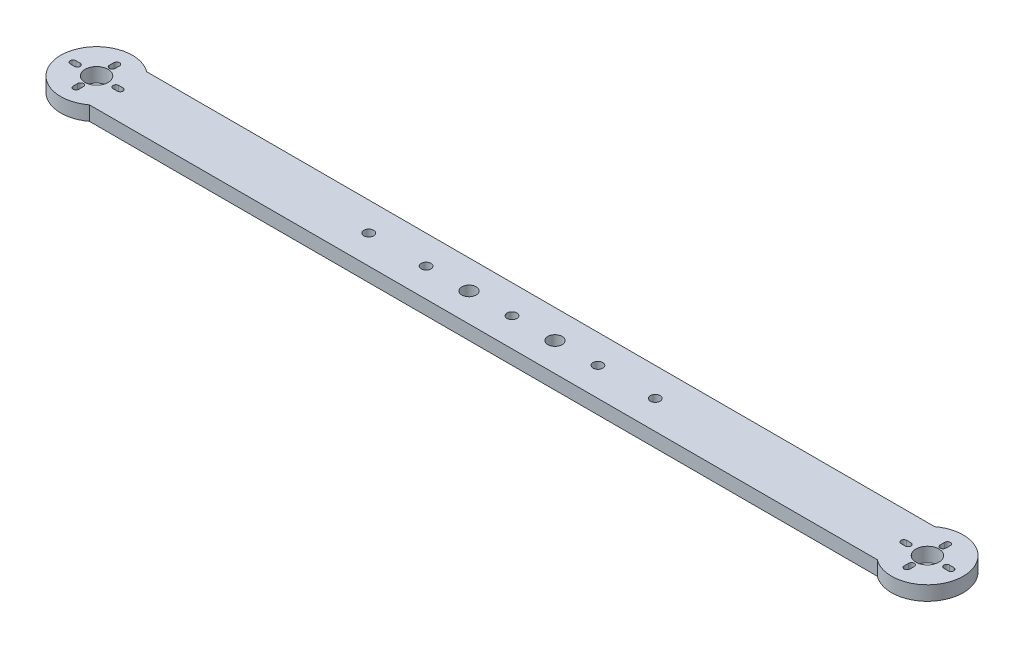
from build123d import *

# Parameters (mm, degrees)
BOSS_EXTRUDE1_DEPTH = 6.35
SKETCH2_R           = 5.08
CUT_EXTRUDE1_DEPTH  = 201.754423986
SKETCH3_R           = 2.159
CUT_EXTRUDE2_DEPTH  = 201.754423986
SKETCH4_R           = 3.175
CUT_EXTRUDE3_DEPTH  = 201.754423986
SKETCH5_R           = 2.159
CUT_EXTRUDE4_DEPTH  = 201.754423986


with BuildPart() as part:
    # Sketch1 → Boss-Extrude1 (new body)
    with BuildSketch(Plane(origin=(0, 0, 0), x_dir=(1, 0, 0), z_dir=(0, 1, 0))):
        with BuildLine():
            Line((-174.625, 12.7), (174.625, 12.7))
            ThreePointArc((174.625, 12.7), (200.025, 0), (174.625, -12.7))
            Line((174.625, -12.7), (-174.625, -12.7))
            ThreePointArc((-174.625, -12.7), (-200.025, 0), (-174.625, 12.7))
        make_face()
    extrude(amount=BOSS_EXTRUDE1_DEPTH)

    # Sketch2 → Cut-Extrude1 (cut, through all)
    with BuildSketch(Plane(origin=(0, 6.35, 0), x_dir=(1, 0, 0), z_dir=(0, 1, 0))):
        with Locations((184.15, 0)):
            Circle(SKETCH2_R)
        with Locations((-184.15, 0)):
            Circle(SKETCH2_R)
        with BuildLine():
            Line((173.691383345, 1.25), (175.608616655, 1.25))
            ThreePointArc((175.608616655, 1.25), (176.858616655, 0), (175.608616655, -1.25))
            Line((175.608616655, -1.25), (173.691383345, -1.25))
            ThreePointArc((173.691383345, -1.25), (172.441383345, 0), (173.691383345, 1.25))
        make_face()
        with BuildLine():
            Line((194.608616655, 1.25), (192.691383345, 1.25))
            ThreePointArc((192.691383345, 1.25), (191.441383345, 0), (192.691383345, -1.25))
            Line((192.691383345, -1.25), (194.608616655, -1.25))
            ThreePointArc((194.608616655, -1.25), (195.858616655, 0), (194.608616655, 1.25))
        make_face()
        with BuildLine():
            Line((185.4, 8.920928665), (185.4, 6.921035691))
            ThreePointArc((185.4, 6.921035691), (184.15, 5.671035691), (182.9, 6.921035691))
            Line((182.9, 6.921035691), (182.9, 8.920928665))
            ThreePointArc((182.9, 8.920928665), (184.15, 10.170928665), (185.4, 8.920928665))
        make_face()
        with BuildLine():
            Line((185.441381345, -9.078964309), (185.441381345, -7.078964309))
            ThreePointArc((185.441381345, -7.078964309), (184.191381345, -5.828964309), (182.941381345, -7.078964309))
            Line((182.941381345, -7.078964309), (182.941381345, -9.078964309))
            ThreePointArc((182.941381345, -9.078964309), (184.191381345, -10.328964309), (185.441381345, -9.078964309))
        make_face()
        with BuildLine():
            Line((-185.441381345, -9.078964309), (-185.441381345, -7.078964309))
            ThreePointArc((-185.441381345, -7.078964309), (-184.191381345, -5.828964309), (-182.941381345, -7.078964309))
            Line((-182.941381345, -7.078964309), (-182.941381345, -9.078964309))
            ThreePointArc((-182.941381345, -9.078964309), (-184.191381345, -10.328964309), (-185.441381345, -9.078964309))
        make_face()
        with BuildLine():
            Line((-185.4, 8.920928665), (-185.4, 6.921035691))
            ThreePointArc((-185.4, 6.921035691), (-184.15, 5.671035691), (-182.9, 6.921035691))
            Line((-182.9, 6.921035691), (-182.9, 8.920928665))
            ThreePointArc((-182.9, 8.920928665), (-184.15, 10.170928665), (-185.4, 8.920928665))
        make_face()
        with BuildLine():
            Line((-194.608616655, 1.25), (-192.691383345, 1.25))
            ThreePointArc((-192.691383345, 1.25), (-191.441383345, 0), (-192.691383345, -1.25))
            Line((-192.691383345, -1.25), (-194.608616655, -1.25))
            ThreePointArc((-194.608616655, -1.25), (-195.858616655, 0), (-194.608616655, 1.25))
        make_face()
        with BuildLine():
            Line((-173.691383345, 1.25), (-175.608616655, 1.25))
            ThreePointArc((-175.608616655, 1.25), (-176.858616655, 0), (-175.608616655, -1.25))
            Line((-175.608616655, -1.25), (-173.691383345, -1.25))
            ThreePointArc((-173.691383345, -1.25), (-172.441383345, 0), (-173.691383345, 1.25))
        make_face()
    extrude(amount=-CUT_EXTRUDE1_DEPTH, mode=Mode.SUBTRACT)

    # Sketch3 → Cut-Extrude2 (cut, through all)
    with BuildSketch(Plane(origin=(0, 6.35, 0), x_dir=(1, 0, 0), z_dir=(0, 1, 0))):
        Circle(SKETCH3_R)
        with Locations((38.1, 0)):
            Circle(SKETCH3_R)
        with Locations((-38.1, 0)):
            Circle(SKETCH3_R)
    extrude(amount=-CUT_EXTRUDE2_DEPTH, mode=Mode.SUBTRACT)

    # Sketch4 → Cut-Extrude3 (cut, through all)
    with BuildSketch(Plane(origin=(0, 6.35, 0), x_dir=(1, 0, 0), z_dir=(0, 1, 0))):
        with Locations((-19.05, 0)):
            Circle(SKETCH4_R)
        with Locations((19.05, 0)):
            Circle(SKETCH4_R)
    extrude(amount=-CUT_EXTRUDE3_DEPTH, mode=Mode.SUBTRACT)

    # Sketch5 → Cut-Extrude4 (cut, through all)
    with BuildSketch(Plane(origin=(0, 6.35, 0), x_dir=(1, 0, 0), z_dir=(0, 1, 0))):
        with Locations((63.5, 0)):
            Circle(SKETCH5_R)
        with Locations((-63.5, 0)):
            Circle(SKETCH5_R)
    extrude(amount=-CUT_EXTRUDE4_DEPTH, mode=Mode.SUBTRACT)


solid = part.part
